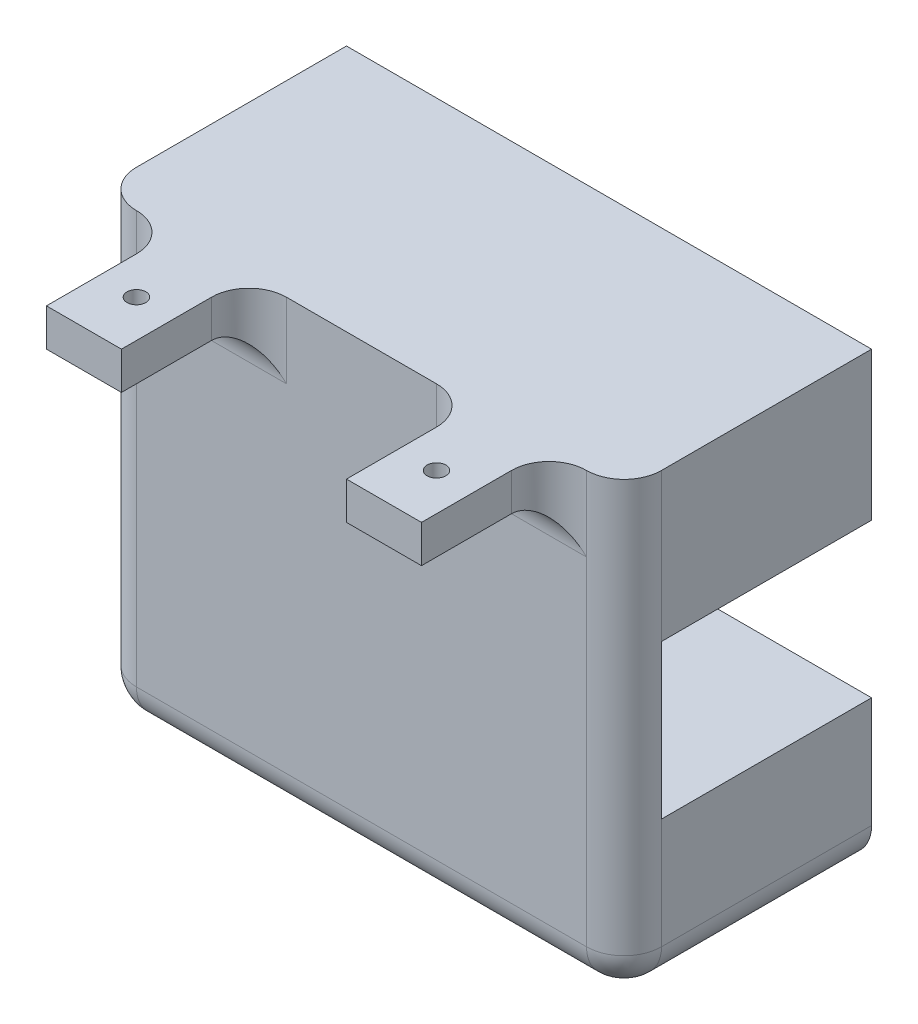
from build123d import *

# Parameters (mm, degrees)
SKETCH_2_W          = 70
SKETCH_2_H          = 60
EXTRUDE_2_DEPTH     = 33
SKETCH_3_W          = 40.7
SKETCH_3_H          = 20.5
CUT_EXTRUDE_1_DEPTH = 28
SKETCH_4_W          = 14.65
SKETCH_4_H          = 20.5
EXTRUDE_3_DEPTH     = 28
SKETCH_5_W          = 14.65
SKETCH_5_H          = 20.5
CUT_EXTRUDE_4_DEPTH = 28
SKETCH_8_W          = 10
SKETCH_8_H          = 5
EXTRUDE_5_DEPTH     = 50
M3X0_5_1_D          = 2.5
FILLET_1_R          = 5
FILLET_2_R          = 5
FILLET_3_R          = 5


# Some blends are built 0.0001 mm under size
with BuildPart() as part:
    # ｽｹｯﾁ2 → ﾎﾞｽ - 押し出し2 (new body)
    with BuildSketch(Plane.XY):
        Rectangle(SKETCH_2_W, SKETCH_2_H)
    extrude(amount=EXTRUDE_2_DEPTH)

    # ｽｹｯﾁ3 → ｶｯﾄ - 押し出し1 (cut)
    with BuildSketch(Plane.XY):
        Rectangle(SKETCH_3_W, SKETCH_3_H)
    extrude(amount=CUT_EXTRUDE_1_DEPTH, mode=Mode.SUBTRACT)

    # ｽｹｯﾁ4 → ﾎﾞｽ - 押し出し3 (add)
    with BuildSketch(Plane.XY):
        with Locations((27.675, 0)):
            Rectangle(SKETCH_4_W, SKETCH_4_H)
    extrude(amount=EXTRUDE_3_DEPTH)

    # ｽｹｯﾁ5 → ｶｯﾄ - 押し出し4 (cut)
    with BuildSketch(Plane.XY):
        with Locations((27.675, 0)):
            Rectangle(SKETCH_5_W, SKETCH_5_H)
    extrude(amount=CUT_EXTRUDE_4_DEPTH, mode=Mode.SUBTRACT)

    # ｽｹｯﾁ8 → ﾎﾞｽ - 押し出し5 (add)
    with BuildSketch(Plane.XY):
        with Locations((-20, 27.5)):
            Rectangle(SKETCH_8_W, SKETCH_8_H)
        with Locations((20, 27.5)):
            Rectangle(SKETCH_8_W, SKETCH_8_H)
    extrude(amount=EXTRUDE_5_DEPTH)

    # M3x0.5 ねじ穴1 (through all)
    with Locations(Plane(origin=(0, 30, 0), x_dir=(1, 0, 0), z_dir=(0, 1, 0))):
        with Locations((-20, -43), (20, -43)):
            Hole(M3X0_5_1_D / 2)

    # ﾌｨﾚｯﾄ1
    fillet_1_edges = [part.edges().sort_by_distance(p)[0] for p in [
        (-15, 27.5, 33),
        (-20, 25, 33),
        (-25, 27.5, 33),
        (20, 25, 33),
        (15, 27.5, 33),
        (25, 27.5, 33),
    ]]
    fillet(fillet_1_edges, radius=FILLET_1_R)

    # ﾌｨﾚｯﾄ2
    fillet_2_edges = [part.edges().sort_by_distance(p)[0] for p in [
        (35, 0, 33),
        (35, -30, 16.5),
        (0, -30, 33),
        (-35, 0, 33),
    ]]
    fillet(fillet_2_edges, radius=FILLET_2_R - 0.0001)  # a hair under: the kernel refuses the full size

    # ﾌｨﾚｯﾄ3
    # the kernel refuses this fillet: 5 mm, written as the material it takes off along each edge
    with BuildSketch(Plane(origin=(-30, -25, 33), x_dir=(-1, 0, 0), z_dir=(0, 1, 0))) as fillet_3_piece_1:
        with BuildLine():
            CenterArc((0.0001, -4.9999), 4.9999, 0, 90)
            Line((5, -4.9999), (5, 0))
            Line((5, 0), (0.0001, 0))
        make_face()
    revolve(axis=Axis((-30, -25, 33), (0, 0, 1)), revolution_arc=90, mode=Mode.SUBTRACT)
    with BuildSketch(Plane(origin=(-35, -30, -12.5), x_dir=(0, 1, 0), z_dir=(0, 0, 1))) as fillet_3_piece_2:
        with BuildLine():
            CenterArc((FILLET_3_R, -FILLET_3_R), FILLET_3_R, 90, 90)
            Line((0, -FILLET_3_R), (0, 0))
            Line((0, 0), (FILLET_3_R, 0))
        make_face()
    extrude(amount=45.5, mode=Mode.SUBTRACT)


solid = part.part
